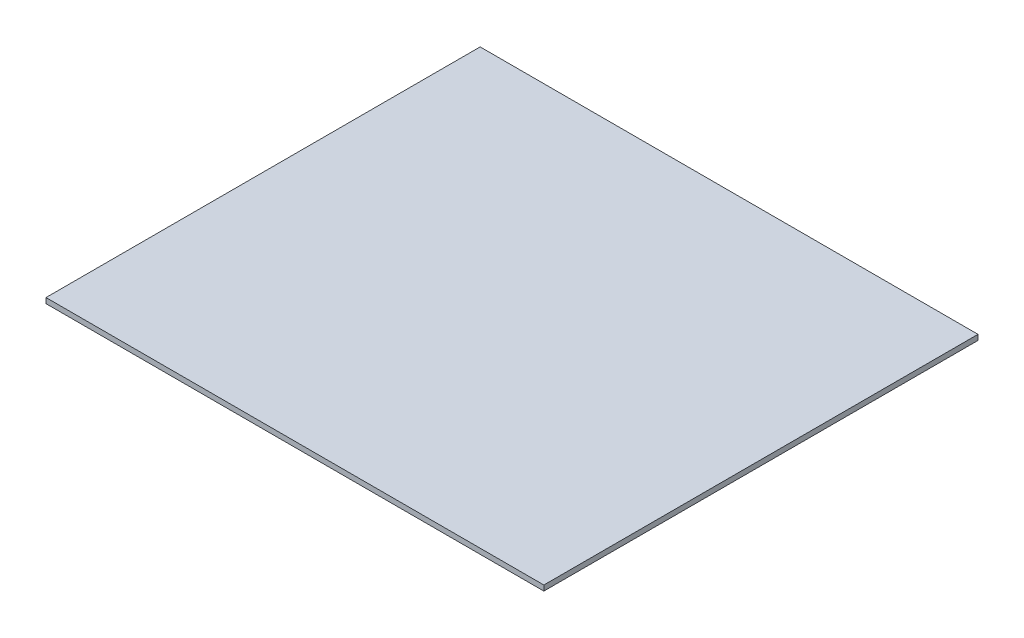
from build123d import *

# Parameters (mm, degrees)
SKETCH1_W           = 595.3125
SKETCH1_H           = 519.1125
BOSS_EXTRUDE1_DEPTH = 6.35


with BuildPart() as part:
    # Sketch1 → Boss-Extrude1 (new body)
    with BuildSketch(Plane(origin=(0, 0, 0), x_dir=(1, 0, 0), z_dir=(0, 1, 0))):
        with Locations((280.350300992, 248.667439802)):
            Rectangle(SKETCH1_W, SKETCH1_H)
    extrude(amount=BOSS_EXTRUDE1_DEPTH)


solid = part.part
